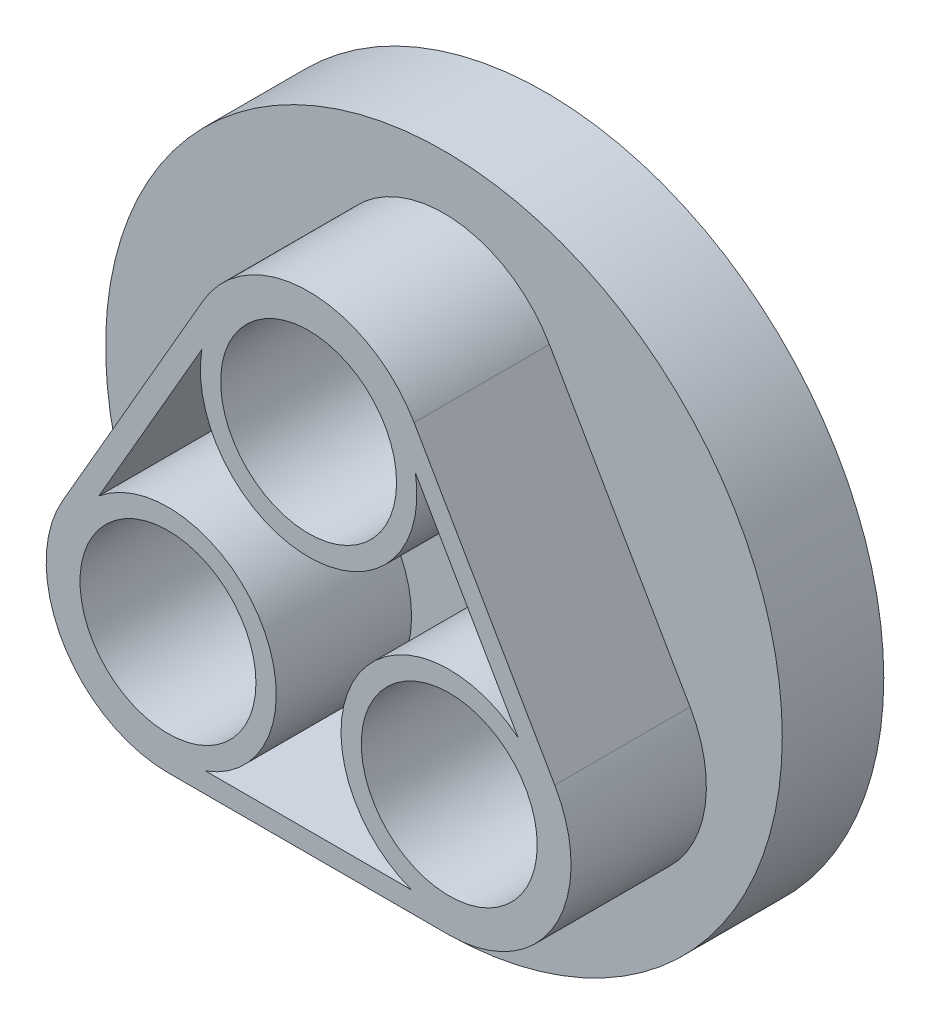
from build123d import *

# Parameters (mm, degrees)
SKETCH_1_R          = 50
EXTRUDE_1_DEPTH     = 15
SHELL_1_T           = -3
EXTRUDE_2_DEPTH     = 20
SKETCH_3_R          = 13
CUT_EXTRUDE_1_DEPTH = 79.89866919
SKETCH_4_R          = 16
SKETCH_4_R_2        = 13
EXTRUDE_3_DEPTH     = 12
SHELL_START         = 15
SHELL_5_DEPTH       = 20


# Read off the part's stored shape, not the designer's step: 薄殼5
with BuildPart() as part:
    # 草圖1 → 填料-伸長1 (new body)
    with BuildSketch(Plane.XY):
        Circle(SKETCH_1_R)
    extrude(amount=EXTRUDE_1_DEPTH)

    # 薄殼1
    shell_1_openings = [part.faces().sort_by_distance(p)[0] for p in [
        (0, 0, 0),
    ]]
    offset(amount=SHELL_1_T, openings=shell_1_openings, kind=Kind.INTERSECTION)

    # 草圖2 → 填料-伸長2 (add)
    with BuildSketch(Plane.XY.offset(15)):
        with BuildLine():
            Line((-15.588457268, 33), (-36.373066959, -3))
            ThreePointArc((-36.373066959, -3), (-36.373066959, -21), (-20.784609691, -30))
            Line((-20.784609691, -30), (20.784609691, -30))
            ThreePointArc((20.784609691, -30), (36.373066959, -21), (36.373066959, -3))
            Line((36.373066959, -3), (15.588457268, 33))
            ThreePointArc((15.588457268, 33), (0, 42), (-15.588457268, 33))
        make_face()
    extrude(amount=EXTRUDE_2_DEPTH)

    # 草圖3 → 除料-伸長1 (cut, through all)
    with BuildSketch(Plane.XY.offset(35)):
        with Locations((0, 24)):
            Circle(SKETCH_3_R)
        with Locations((-20.784609691, -12)):
            Circle(SKETCH_3_R)
        with Locations((20.784609691, -12)):
            Circle(SKETCH_3_R)
    extrude(amount=-CUT_EXTRUDE_1_DEPTH, mode=Mode.SUBTRACT)

    # 草圖4 → 填料-伸長3 (add)
    # profile 1 of 3: a face of its own
    with BuildSketch(Plane(origin=(0, 0, 12), x_dir=(-1, 0, 0), z_dir=(0, 0, -1))):
        with Locations(Location((0, 24, 0), (0, 0, 180))):
            Circle(SKETCH_4_R)
        with Locations(Location((0, 24, 0), (0, 0, 180))):
            Circle(SKETCH_4_R_2, mode=Mode.SUBTRACT)
    # profile 2 of 3: a face of its own
    with BuildSketch(Plane(origin=(0, 0, 12), x_dir=(-1, 0, 0), z_dir=(0, 0, -1))):
        with Locations(Location((20.784609691, -12, 0), (0, 0, 180))):
            Circle(SKETCH_4_R)
        with Locations(Location((20.784609691, -12, 0), (0, 0, 180))):
            Circle(SKETCH_4_R_2, mode=Mode.SUBTRACT)
    # profile 3 of 3: a face of its own
    with BuildSketch(Plane(origin=(0, 0, 12), x_dir=(-1, 0, 0), z_dir=(0, 0, -1))):
        with Locations(Location((-20.784609691, -12, 0), (0, 0, 180))):
            Circle(SKETCH_4_R)
        with Locations(Location((-20.784609691, -12, 0), (0, 0, 180))):
            Circle(SKETCH_4_R_2, mode=Mode.SUBTRACT)
    extrude(amount=EXTRUDE_3_DEPTH)

    # 薄殼5 outline → 薄殼5 (cut)
    with BuildSketch(Plane.XY.offset(SHELL_START)):
        with BuildLine():
            ThreePointArc((15.774263238, 26.67817462), (0, 8), (-15.774263238, 26.67817462))
            Line((-15.774263238, 26.67817462), (-30.991108566, 0.32182538))
            ThreePointArc((-30.991108566, 0.32182538), (-6.92820323, -4), (-15.216845328, -27))
            Line((-15.216845328, -27), (15.216845328, -27))
            ThreePointArc((15.216845328, -27), (6.92820323, -4), (30.991108566, 0.32182538))
            Line((30.991108566, 0.32182538), (15.774263238, 26.67817462))
        make_face()
    extrude(amount=SHELL_5_DEPTH, mode=Mode.SUBTRACT)


solid = part.part
